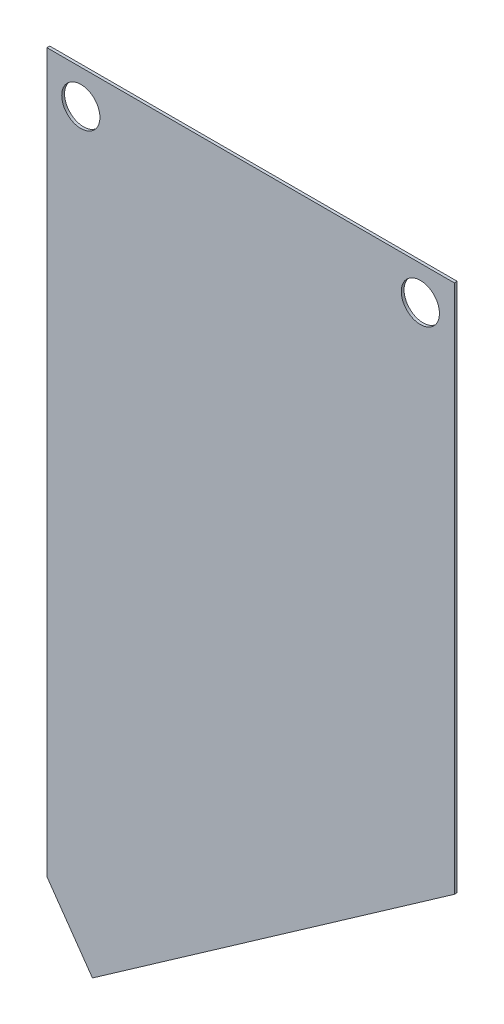
from build123d import *

# Parameters (mm, degrees)
SKETCH1_W           = 304.8
SKETCH1_H           = 609.6
BOSS_EXTRUDE1_DEPTH = 2.1082
CUT_EXTRUDE1_DEPTH  = 2.1082
SKETCH3_R           = 14.2875
CUT_EXTRUDE2_DEPTH  = 2.1082
SKETCH4_R           = 14.2875
CUT_EXTRUDE3_DEPTH  = 2.1082


with BuildPart() as part:
    # Sketch1 → Boss-Extrude1 (new body)
    with BuildSketch(Plane.XY):
        with Locations((101.6, -304.8)):
            Rectangle(SKETCH1_W, SKETCH1_H)
    extrude(amount=BOSS_EXTRUDE1_DEPTH)

    # Sketch2 → Cut-Extrude1 (cut)
    with BuildSketch(Plane.XY.offset(2.1082)):
        Polygon((-50.8, -537.050081257), (-16.71268836, -585.731807432), (255.723406687, -394.97), (255.723406687, -609.6), (-50.8, -609.6), align=None)
    extrude(amount=-CUT_EXTRUDE1_DEPTH, mode=Mode.SUBTRACT)

    # Sketch3 → Cut-Extrude2 (cut)
    with BuildSketch(Plane(origin=(0, 0, 0), x_dir=(-1, 0, 0), z_dir=(0, 0, -1))):
        with Locations((25.4, -25.4)):
            Circle(SKETCH3_R)
    extrude(amount=-CUT_EXTRUDE2_DEPTH, mode=Mode.SUBTRACT)

    # Sketch4 → Cut-Extrude3 (cut)
    with BuildSketch(Plane(origin=(0, 0, 0), x_dir=(-1, 0, 0), z_dir=(0, 0, -1))):
        with Locations((-228.6, -25.4)):
            Circle(SKETCH4_R)
    extrude(amount=-CUT_EXTRUDE3_DEPTH, mode=Mode.SUBTRACT)


solid = part.part
